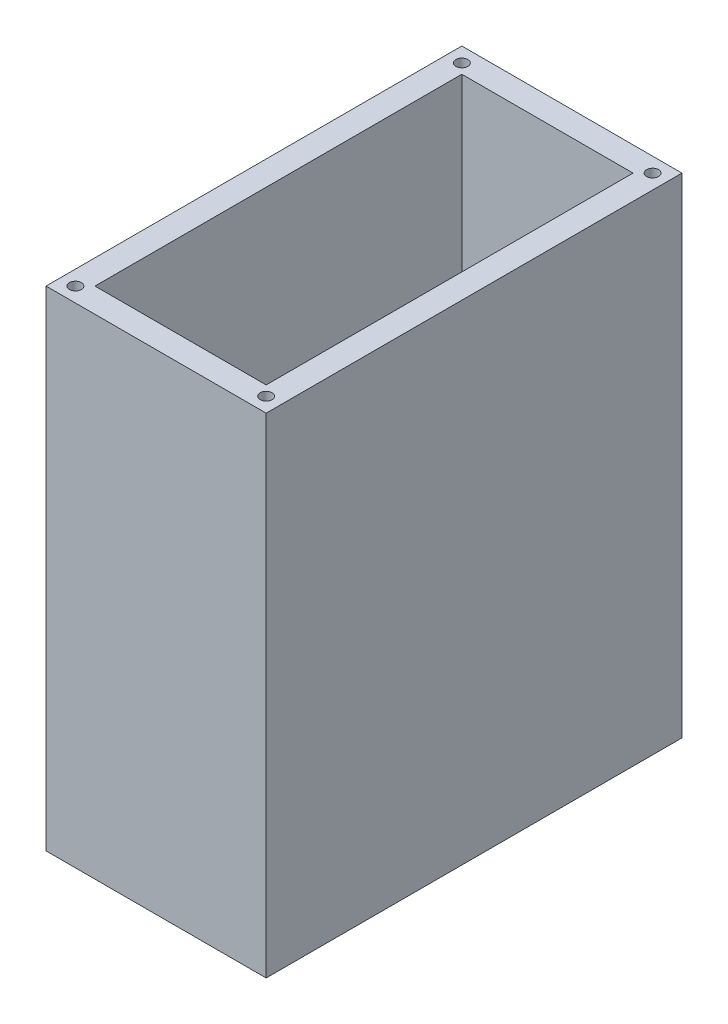
from build123d import *

# Parameters (mm, degrees)
SKETCH1_W           = 45
SKETCH1_H           = 85
BOSS_EXTRUDE1_DEPTH = 100
SHELL1_T            = -5
BOSS_EXTRUDE2_DEPTH = 15
SKETCH4_W           = 20
SKETCH4_H           = 2.5
BOSS_EXTRUDE3_DEPTH = 1
SKETCH5_W           = 15.809094042
SKETCH5_H           = 2
BOSS_EXTRUDE4_DEPTH = 1
SKETCH6_W           = 10
SKETCH6_H           = 2.5
BOSS_EXTRUDE5_DEPTH = 1
SKETCH9_W           = 10.477527882
SKETCH9_H           = 6.322646136
CUT_EXTRUDE1_DEPTH  = 9
SKETCH10_R          = 1.225
CUT_EXTRUDE2_DEPTH  = 20


with BuildPart() as part:
    # Sketch1 → Boss-Extrude1 (new body)
    with BuildSketch(Plane(origin=(0, 0, 0), x_dir=(1, 0, 0), z_dir=(0, 1, 0))):
        Rectangle(SKETCH1_W, SKETCH1_H)
    extrude(amount=BOSS_EXTRUDE1_DEPTH)

    # Shell1
    shell1_openings = [part.faces().sort_by_distance(p)[0] for p in [
        (0, 100, 0),
    ]]
    offset(amount=SHELL1_T, openings=shell1_openings, kind=Kind.INTERSECTION)

    # Sketch2 → Boss-Extrude2 (add)
    with BuildSketch(Plane(origin=(0, 5, 0), x_dir=(1, 0, 0), z_dir=(0, 1, 0))):
        with BuildLine():
            Line((-16.25, 0), (-16.25, -32))
            Line((-16.25, -32), (1.75, -32))
            Line((1.75, -32), (1.75, -13.133925537))
            ThreePointArc((1.75, -13.133925537), (0.251618147, -13.247610664), (-1.25, -13.190905958))
            Line((-1.25, -13.190905958), (-1.25, -29))
            Line((-1.25, -29), (-13.25, -29))
            Line((-13.25, -29), (-13.25, 0))
            Line((-13.25, 0), (-16.25, 0))
        make_face()
        with BuildLine():
            Line((-4.205809483, 15.696294677), (-3.429352348, 12.798517198))
            ThreePointArc((-3.429352348, 12.798517198), (0, 13.25), (3.429352348, 12.798517198))
            Line((3.429352348, 12.798517198), (4.205809483, 15.696294677))
            ThreePointArc((4.205809483, 15.696294677), (0, 16.25), (-4.205809483, 15.696294677))
        make_face()
    extrude(amount=BOSS_EXTRUDE2_DEPTH)

    # Sketch4 → Boss-Extrude3 (add)
    with BuildSketch(Plane(origin=(-13.25, 0, 0), x_dir=(0, 0, -1), z_dir=(1, 0, 0))):
        with Locations((-19, 18.75)):
            Rectangle(SKETCH4_W, SKETCH4_H)
    extrude(amount=BOSS_EXTRUDE3_DEPTH)

    # Sketch5 → Boss-Extrude4 (add)
    with BuildSketch(Plane.ZY.offset(1.25)):
        with Locations((21.095452979, 19)):
            Rectangle(SKETCH5_W, SKETCH5_H)
    extrude(amount=BOSS_EXTRUDE4_DEPTH)

    # Sketch6 → Boss-Extrude5 (add)
    with BuildSketch(Plane(origin=(0, 0, 29), x_dir=(-1, 0, 0), z_dir=(0, 0, -1))):
        with Locations((7.25, 18.75)):
            Rectangle(SKETCH6_W, SKETCH6_H)
    extrude(amount=BOSS_EXTRUDE5_DEPTH)

    # Sketch9 → Cut-Extrude1 (cut)
    with BuildSketch(Plane(origin=(0, 20, 0), x_dir=(1, 0, 0), z_dir=(0, 1, 0))):
        with Locations((0.163497959, 14.216347227)):
            Rectangle(SKETCH9_W, SKETCH9_H)
    extrude(amount=-CUT_EXTRUDE1_DEPTH, mode=Mode.SUBTRACT)

    # Sketch10 → Cut-Extrude2 (cut)
    with BuildSketch(Plane(origin=(0, 100, 0), x_dir=(1, 0, 0), z_dir=(0, 1, 0))):
        with Locations((-19.5, 39.5)):
            Circle(SKETCH10_R)
        with Locations((19.5, 39.5)):
            Circle(SKETCH10_R)
        with Locations((-19.5, -39.5)):
            Circle(SKETCH10_R)
        with Locations((19.5, -39.5)):
            Circle(SKETCH10_R)
    extrude(amount=-CUT_EXTRUDE2_DEPTH, mode=Mode.SUBTRACT)


solid = part.part
